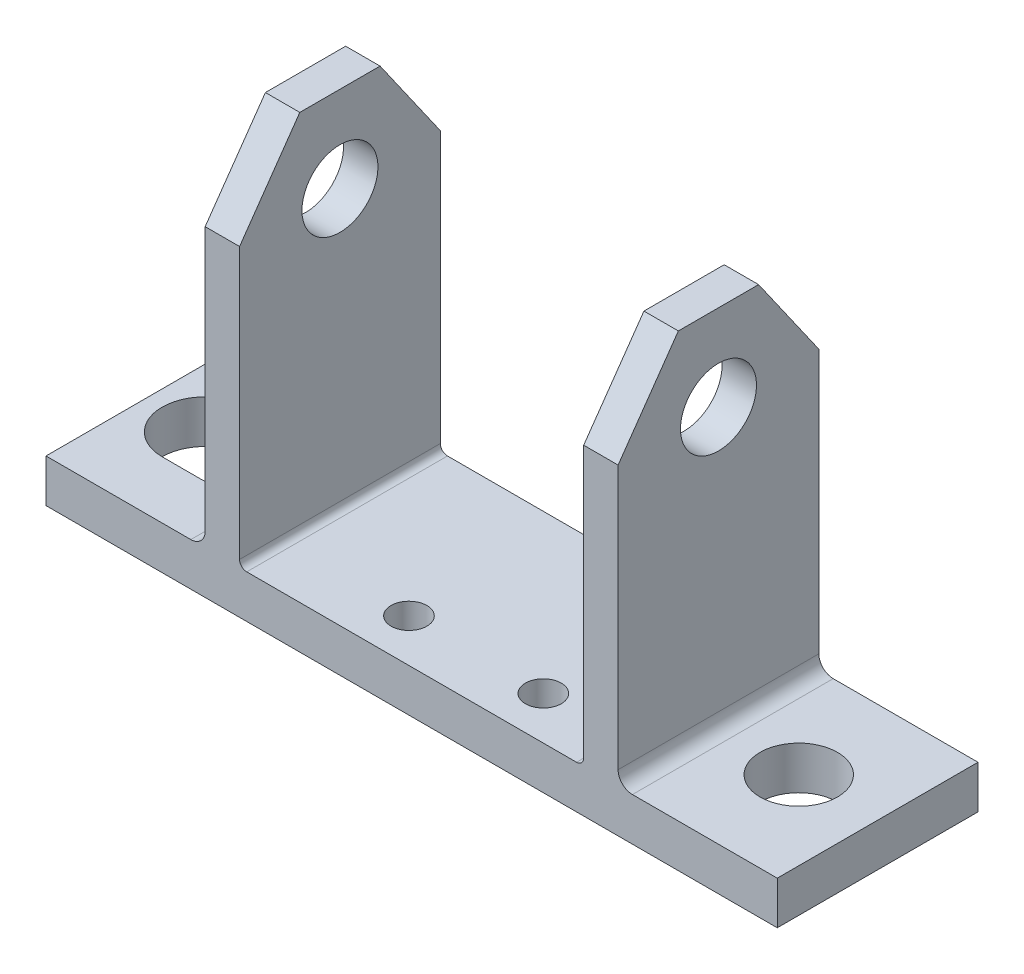
from build123d import *

# Parameters (mm, degrees)
SKETCH1_W           = 51
SKETCH1_H           = 14
SKETCH1_R           = 2.7
BOSS_EXTRUDE1_DEPTH = 3
SKETCH2_W           = 2.4
SKETCH2_H           = 14
BOSS_EXTRUDE2_DEPTH = 25.4
CUT_EXTRUDE1_REACH  = 60.67
SKETCH3_R           = 1.25
SKETCH4_R           = 2.65
CUT_EXTRUDE2_DEPTH  = 51.936921776
CUT_EXTRUDE3_DEPTH  = 51.936921776
FILLET1_R           = 1
FILLET2_R           = 0.5


with BuildPart() as part:
    # Sketch1 → Boss-Extrude1 (new body)
    with BuildSketch(Plane(origin=(0, 0, 0), x_dir=(1, 0, 0), z_dir=(0, 1, 0))):
        with Locations((25.5, 7)):
            Rectangle(SKETCH1_W, SKETCH1_H)
        with Locations((45.5, 7)):
            Circle(SKETCH1_R, mode=Mode.SUBTRACT)
        with BuildLine():
            Line((4.1, 10), (6.9, 10))
            ThreePointArc((6.9, 10), (9.9, 7), (6.9, 4))
            Line((6.9, 4), (4.1, 4))
            ThreePointArc((4.1, 4), (1.1, 7), (4.1, 10))
        make_face(mode=Mode.SUBTRACT)
    extrude(amount=BOSS_EXTRUDE1_DEPTH)

    # Sketch2 → Boss-Extrude2 (add)
    with BuildSketch(Plane(origin=(0, 3, 0), x_dir=(1, 0, 0), z_dir=(0, 1, 0))):
        with Locations((12.3, 7)):
            Rectangle(SKETCH2_W, SKETCH2_H)
        with Locations((38.7, 7)):
            Rectangle(SKETCH2_W, SKETCH2_H)
    extrude(amount=BOSS_EXTRUDE2_DEPTH)

    # Sketch3 → Cut-Extrude1 (cut, up to next)
    with BuildSketch(Plane(origin=(0, 3, 0), x_dir=(1, 0, 0), z_dir=(0, 1, 0)), mode=Mode.PRIVATE) as cut_extrude1_sk1:
        with Locations((22.314, 3)):
            Circle(SKETCH3_R)
    cut_extrude1_tool1 = extrude(cut_extrude1_sk1.sketch, amount=-CUT_EXTRUDE1_REACH, mode=Mode.PRIVATE) & part.part
    # Sketch3 → Cut-Extrude1 (cut, up to next)
    with BuildSketch(Plane(origin=(0, 3, 0), x_dir=(1, 0, 0), z_dir=(0, 1, 0)), mode=Mode.PRIVATE) as cut_extrude1_sk2:
        with Locations((31.686, 3)):
            Circle(SKETCH3_R)
    cut_extrude1_tool2 = extrude(cut_extrude1_sk2.sketch, amount=-CUT_EXTRUDE1_REACH, mode=Mode.PRIVATE) & part.part
    add(cut_extrude1_tool1.solids().sort_by_distance((22.314, 3, -3))[0], mode=Mode.SUBTRACT)
    add(cut_extrude1_tool2.solids().sort_by_distance((31.686, 3, -3))[0], mode=Mode.SUBTRACT)

    # Sketch4 → Cut-Extrude2 (cut, through all)
    with BuildSketch(Plane.ZY.offset(-11.1)):
        with Locations((-7, 22.4)):
            Circle(SKETCH4_R)
    extrude(amount=-CUT_EXTRUDE2_DEPTH, mode=Mode.SUBTRACT)

    # Sketch5 → Cut-Extrude3 (cut, through all)
    with BuildSketch(Plane.ZY.offset(-11.1)):
        Polygon((-14, 22.4), (-9.798754771, 28.4), (-14, 28.4), align=None)
        Polygon((0, 22.4), (-4.201245229, 28.4), (0, 28.4), align=None)
    extrude(amount=-CUT_EXTRUDE3_DEPTH, mode=Mode.SUBTRACT)

    # Fillet1
    fillet1_edges = [part.edges().sort_by_distance(p)[0] for p in [
        (39.9, 3, -7),
        (11.1, 3, -7),
    ]]
    fillet(fillet1_edges, radius=FILLET1_R)

    # Fillet2
    fillet2_edges = [part.edges().sort_by_distance(p)[0] for p in [
        (37.5, 3, -7),
        (13.5, 3, -7),
    ]]
    fillet(fillet2_edges, radius=FILLET2_R)


solid = part.part
